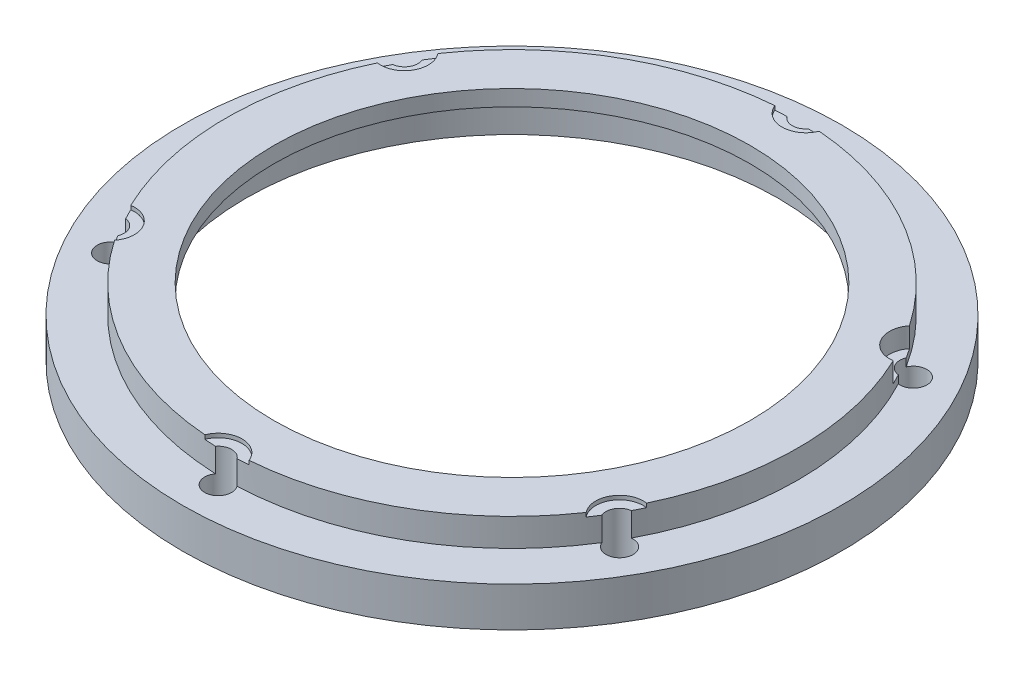
from build123d import *

# Parameters (mm, degrees)
SKETCH_3_R                      = 1.7
CUT_EXTRUDE_1_DEPTH             = 10
CUT_EXTRUDE_1_DIRECTION_2_REACH = 60.902
CUT_EXTRUDE_START               = 3
SKETCH_4_R                      = 3
CUT_EXTRUDE_2_DEPTH             = 3
SKETCH_7_R                      = 3
CUT_EXTRUDE_3_DEPTH             = 10
EXTRUDE_1_DEPTH                 = 1


with BuildPart() as part:
    # 草图2 → 旋转1 (revolve)
    with BuildSketch(Plane(origin=(0, 0, 0), x_dir=(0, 0, -1), z_dir=(1, 0, 0))):
        Polygon((-30, 0), (-30, 2), (-36, 2), (-36, -1.5), (-41.5, -1.5), (-41.5, -6.5), (-35, -6.5), (-35, -5.5), (-33.5, -5.5), (-33.5, 0), align=None)
    revolve(axis=Axis((0, 0, 0), (0, 1, 0)))

    # 草图3 → 切除-拉伸1 (cut)
    with BuildSketch(Plane(origin=(0, -1.5, 0), x_dir=(1, 0, 0), z_dir=(0, 1, 0))):
        with Locations((0, 37)):
            Circle(SKETCH_3_R)
        with Locations((32.04293994, 18.5)):
            Circle(SKETCH_3_R)
        with Locations((32.04293994, -18.5)):
            Circle(SKETCH_3_R)
        with Locations((0, -37)):
            Circle(SKETCH_3_R)
        with Locations((-32.04293994, -18.5)):
            Circle(SKETCH_3_R)
        with Locations((-32.04293994, 18.5)):
            Circle(SKETCH_3_R)
    extrude(amount=-CUT_EXTRUDE_1_DEPTH, mode=Mode.SUBTRACT)

    # 草图3 → 切除-拉伸1 direction 2 (cut, up to next)
    with BuildSketch(Plane(origin=(0, -1.5, 0), x_dir=(1, 0, 0), z_dir=(0, 1, 0)), mode=Mode.PRIVATE) as cut_extrude_1_direction_2_sk1:
        with Locations((0, 37)):
            Circle(SKETCH_3_R)
    cut_extrude_1_direction_2_tool1 = extrude(cut_extrude_1_direction_2_sk1.sketch, amount=CUT_EXTRUDE_1_DIRECTION_2_REACH, mode=Mode.PRIVATE) & part.part
    # 草图3 → 切除-拉伸1 direction 2 (cut, up to next)
    with BuildSketch(Plane(origin=(0, -1.5, 0), x_dir=(1, 0, 0), z_dir=(0, 1, 0)), mode=Mode.PRIVATE) as cut_extrude_1_direction_2_sk2:
        with Locations((32.04293994, 18.5)):
            Circle(SKETCH_3_R)
    cut_extrude_1_direction_2_tool2 = extrude(cut_extrude_1_direction_2_sk2.sketch, amount=CUT_EXTRUDE_1_DIRECTION_2_REACH, mode=Mode.PRIVATE) & part.part
    # 草图3 → 切除-拉伸1 direction 2 (cut, up to next)
    with BuildSketch(Plane(origin=(0, -1.5, 0), x_dir=(1, 0, 0), z_dir=(0, 1, 0)), mode=Mode.PRIVATE) as cut_extrude_1_direction_2_sk3:
        with Locations((32.04293994, -18.5)):
            Circle(SKETCH_3_R)
    cut_extrude_1_direction_2_tool3 = extrude(cut_extrude_1_direction_2_sk3.sketch, amount=CUT_EXTRUDE_1_DIRECTION_2_REACH, mode=Mode.PRIVATE) & part.part
    # 草图3 → 切除-拉伸1 direction 2 (cut, up to next)
    with BuildSketch(Plane(origin=(0, -1.5, 0), x_dir=(1, 0, 0), z_dir=(0, 1, 0)), mode=Mode.PRIVATE) as cut_extrude_1_direction_2_sk4:
        with Locations((0, -37)):
            Circle(SKETCH_3_R)
    cut_extrude_1_direction_2_tool4 = extrude(cut_extrude_1_direction_2_sk4.sketch, amount=CUT_EXTRUDE_1_DIRECTION_2_REACH, mode=Mode.PRIVATE) & part.part
    # 草图3 → 切除-拉伸1 direction 2 (cut, up to next)
    with BuildSketch(Plane(origin=(0, -1.5, 0), x_dir=(1, 0, 0), z_dir=(0, 1, 0)), mode=Mode.PRIVATE) as cut_extrude_1_direction_2_sk5:
        with Locations((-32.04293994, -18.5)):
            Circle(SKETCH_3_R)
    cut_extrude_1_direction_2_tool5 = extrude(cut_extrude_1_direction_2_sk5.sketch, amount=CUT_EXTRUDE_1_DIRECTION_2_REACH, mode=Mode.PRIVATE) & part.part
    # 草图3 → 切除-拉伸1 direction 2 (cut, up to next)
    with BuildSketch(Plane(origin=(0, -1.5, 0), x_dir=(1, 0, 0), z_dir=(0, 1, 0)), mode=Mode.PRIVATE) as cut_extrude_1_direction_2_sk6:
        with Locations((-32.04293994, 18.5)):
            Circle(SKETCH_3_R)
    cut_extrude_1_direction_2_tool6 = extrude(cut_extrude_1_direction_2_sk6.sketch, amount=CUT_EXTRUDE_1_DIRECTION_2_REACH, mode=Mode.PRIVATE) & part.part
    add(cut_extrude_1_direction_2_tool1.solids().sort_by_distance((0, -1.5, -37))[0], mode=Mode.SUBTRACT)
    add(cut_extrude_1_direction_2_tool2.solids().sort_by_distance((32.04294, -1.5, -18.5))[0], mode=Mode.SUBTRACT)
    add(cut_extrude_1_direction_2_tool3.solids().sort_by_distance((32.04294, -1.5, 18.5))[0], mode=Mode.SUBTRACT)
    add(cut_extrude_1_direction_2_tool4.solids().sort_by_distance((0, -1.5, 37))[0], mode=Mode.SUBTRACT)
    add(cut_extrude_1_direction_2_tool5.solids().sort_by_distance((-32.04294, -1.5, 18.5))[0], mode=Mode.SUBTRACT)
    add(cut_extrude_1_direction_2_tool6.solids().sort_by_distance((-32.04294, -1.5, -18.5))[0], mode=Mode.SUBTRACT)

    # 草图4 → 切除-拉伸2 (cut)
    with BuildSketch(Plane(origin=(0, -1.5, 0), x_dir=(1, 0, 0), z_dir=(0, 1, 0)).offset(CUT_EXTRUDE_START)):
        with Locations((0, 37)):
            Circle(SKETCH_4_R)
        with Locations((32.04293994, 18.5)):
            Circle(SKETCH_4_R)
        with Locations((32.04293994, -18.5)):
            Circle(SKETCH_4_R)
        with Locations((0, -37)):
            Circle(SKETCH_4_R)
        with Locations((-32.04293994, -18.5)):
            Circle(SKETCH_4_R)
        with Locations((-32.04293994, 18.5)):
            Circle(SKETCH_4_R)
    extrude(amount=CUT_EXTRUDE_2_DEPTH, mode=Mode.SUBTRACT)

    # 草图7 → 切除-拉伸3 (cut)
    with BuildSketch(Plane(origin=(0, -1.5, 0), x_dir=(1, 0, 0), z_dir=(0, 1, 0))):
        with Locations((32.04293994, 18.5)):
            Circle(SKETCH_7_R)
    extrude(amount=CUT_EXTRUDE_3_DEPTH, mode=Mode.SUBTRACT)

    # 草图8 → 凸台-拉伸1 (add)
    with BuildSketch(Plane(origin=(0, -1.5, 0), x_dir=(1, 0, 0), z_dir=(0, 1, 0))):
        with BuildLine():
            ThreePointArc((30.476882326, 19.161410274), (30.089095942, 19.764774357), (29.689366173, 20.360293128))
            ThreePointArc((29.689366173, 20.360293128), (29.444863729, 17), (32.477214164, 15.531598764))
            ThreePointArc((32.477214164, 15.531598764), (32.161344664, 16.175534285), (31.832709232, 16.813049186))
            ThreePointArc((31.832709232, 16.813049186), (30.570696754, 17.65), (30.476882326, 19.161410274))
        make_face()
    extrude(amount=EXTRUDE_1_DEPTH)


solid = part.part
